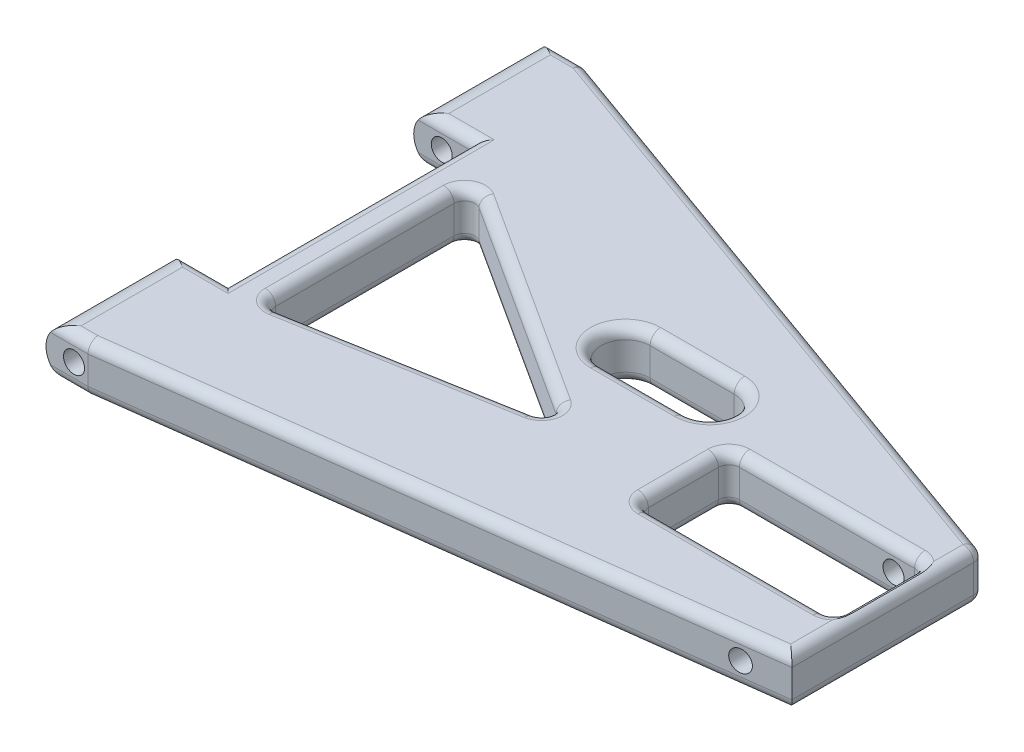
from build123d import *

# Parameters (mm, degrees)
A_ARM_SKETCH_W          = 28
A_ARM_SKETCH_H          = 13
MAIN_EXTRUDE_DEPTH      = 7
COMPLETE_FILLET_R       = 1.5
FILLET2_R               = 3.5
CUT_EXTRUDE1_DEPTH      = 61.922106387
CUT_EXTRUDE1_DEPTH_BACK = 61.922106387
SKETCH1_R               = 1.5
CUT_EXTRUDE2_DEPTH      = 72.144219873
CUT_EXTRUDE2_DEPTH_BACK = 72.144219873
SKETCH2_R               = 1.5


with BuildPart() as part:
    # A_Arm_Sketch → Main_Extrude (new body)
    with BuildSketch(Plane(origin=(0, 0, 0), x_dir=(1, 0, 0), z_dir=(0, 1, 0))):
        Polygon((47.5, -23.500040376), (47.5, 3.500040376), (-40.5, 35), (-47.5, 35), (-47.5, 17.5), (-39, 17.5), (-39, -17.5), (-47.5, -17.5), (-47.5, -35), (-41.5, -35), align=None)
        Polygon((-34, -17.5), (-34, 12.5), (2.5, -11.042410591), align=None, mode=Mode.SUBTRACT)
        with Locations((31.500807525, -9.000040376)):
            Rectangle(A_ARM_SKETCH_W, A_ARM_SKETCH_H, mode=Mode.SUBTRACT)
        with BuildLine():
            ThreePointArc((-2.415267105, -0.833141073), (-5.915267105, 2.666858927), (-2.415267105, 6.166858927))
            Line((-2.415267105, 6.166858927), (9.584732895, 6.166858927))
            ThreePointArc((9.584732895, 6.166858927), (13.084732895, 2.666858927), (9.584732895, -0.833141073))
            Line((9.584732895, -0.833141073), (-2.415267105, -0.833141073))
        make_face(mode=Mode.SUBTRACT)
    extrude(amount=MAIN_EXTRUDE_DEPTH)

    # Complete_Fillet
    # the kernel refuses this fillet: 1.5 mm, written as the material it adds along each edge
    with BuildSketch(Plane(origin=(17.500807525, 0, 2.500040376), x_dir=(0, 0, 1), z_dir=(0, 1, 0)), Plane(origin=(45.500807525, 0, 15.500040376), x_dir=(0, 0, -1), z_dir=(0, 1, 0)), Plane(origin=(45.500807525, 0, 2.500040376), x_dir=(-1, 0, 0), z_dir=(0, 1, 0))) as complete_fillet_piece_1:
        with BuildLine():
            CenterArc((COMPLETE_FILLET_R, COMPLETE_FILLET_R), COMPLETE_FILLET_R, 180, 90)
            Line((0, COMPLETE_FILLET_R), (0, 0))
            Line((0, 0), (COMPLETE_FILLET_R, 0))
        make_face()
    extrude(amount=7)
    with BuildSketch(Plane(origin=(17.500807525, 0, 15.500040376), x_dir=(0, 0, -1), z_dir=(0, 1, 0))) as complete_fillet_piece_2:
        with BuildLine():
            CenterArc((COMPLETE_FILLET_R, -COMPLETE_FILLET_R), COMPLETE_FILLET_R, 90, 90)
            Line((0, -COMPLETE_FILLET_R), (0, 0))
            Line((0, 0), (COMPLETE_FILLET_R, 0))
        make_face()
    extrude(amount=7)
    with BuildSketch(Plane(origin=(-34, 0, 17.5), x_dir=(0, 0, -1), z_dir=(0, 1, 0))) as complete_fillet_piece_3:
        with BuildLine():
            CenterArc((COMPLETE_FILLET_R * 1.19245005923, -COMPLETE_FILLET_R), COMPLETE_FILLET_R, 90, 100.032963932)
            Line((COMPLETE_FILLET_R * 0.207742374056, -COMPLETE_FILLET_R * 1.17421473751), (0, 0))
            Line((0, 0), (COMPLETE_FILLET_R * 1.19245005923, 0))
        make_face()
    extrude(amount=7)
    with BuildSketch(Plane(origin=(2.5, 0, 11.042410591), x_dir=(-0.8403593260849083, 0, -0.5420297068077715), z_dir=(0, 1, 0))) as complete_fillet_piece_4:
        with BuildLine():
            CenterArc((COMPLETE_FILLET_R * 2.54810634239, COMPLETE_FILLET_R), COMPLETE_FILLET_R, 132.854880893, 137.145119107)
            Line((COMPLETE_FILLET_R * 1.8679625451, COMPLETE_FILLET_R * 1.73307872361), (0, 0))
            Line((0, 0), (COMPLETE_FILLET_R * 2.54810634239, 0))
        make_face()
    extrude(amount=7)
    with BuildSketch(Plane(origin=(-34, 0, -12.5), x_dir=(0, 0, 1), z_dir=(0, 1, 0))) as complete_fillet_piece_5:
        with BuildLine():
            CenterArc((COMPLETE_FILLET_R * 1.83496470967, COMPLETE_FILLET_R), COMPLETE_FILLET_R, 147.178083039, 122.821916961)
            Line((COMPLETE_FILLET_R * 0.994605383585, COMPLETE_FILLET_R * 1.54202970681), (0, 0))
            Line((0, 0), (COMPLETE_FILLET_R * 1.83496470967, 0))
        make_face()
    extrude(amount=7)
    # the kernel refuses this fillet: 1.5 mm, written as the material it takes off along each edge
    with BuildSketch(Plane(origin=(-40.760376302, 1.5, -33.5), x_dir=(0, 0, -1), z_dir=(0, -1, 0))) as complete_fillet_2_piece_1_section:
        Polygon((0, 0), (COMPLETE_FILLET_R, 0), (COMPLETE_FILLET_R, COMPLETE_FILLET_R * 0.173584201037), (COMPLETE_FILLET_R * 0.941499749138, COMPLETE_FILLET_R * 0.337013682768), align=None)
    complete_fillet_2_piece_1 = extrude(amount=COMPLETE_FILLET_R, mode=Mode.PRIVATE)
    complete_fillet_2_piece_1 = complete_fillet_2_piece_1 - Plane(origin=(-40.760376302, 1.5, -33.5), x_dir=(-0.17102668046529312, 0, 0.9852663977671331), z_dir=(0, -1, 0)) * Sphere(COMPLETE_FILLET_R, mode=Mode.PRIVATE)
    add(complete_fillet_2_piece_1, mode=Mode.SUBTRACT)
    with BuildSketch(Plane(origin=(46, 1.5, -2.443768745), x_dir=(1, 0, 0), z_dir=(0, -1, 0))) as complete_fillet_2_piece_2_section:
        Polygon((0, 0), (COMPLETE_FILLET_R, 0), (COMPLETE_FILLET_R, -COMPLETE_FILLET_R * 0.704181087503), (COMPLETE_FILLET_R * 0.337013682768, -COMPLETE_FILLET_R * 0.941499749138), align=None)
    complete_fillet_2_piece_2 = extrude(amount=COMPLETE_FILLET_R, mode=Mode.PRIVATE)
    complete_fillet_2_piece_2 = complete_fillet_2_piece_2 - Plane(origin=(46, 1.5, -2.443768745), x_dir=(-0.817622676657215, 0, 0.5757544256155495), z_dir=(0, -1, 0)) * Sphere(COMPLETE_FILLET_R, mode=Mode.PRIVATE)
    add(complete_fillet_2_piece_2, mode=Mode.SUBTRACT)
    with BuildSketch(Plane(origin=(-40.760376302, 5.5, -33.5), x_dir=(0, 0, -1), z_dir=(0, 1, 0))) as complete_fillet_2_piece_3_section:
        Polygon((0, 0), (COMPLETE_FILLET_R, 0), (COMPLETE_FILLET_R, -COMPLETE_FILLET_R * 0.173584201037), (COMPLETE_FILLET_R * 0.941499749138, -COMPLETE_FILLET_R * 0.337013682768), align=None)
    complete_fillet_2_piece_3 = extrude(amount=COMPLETE_FILLET_R, mode=Mode.PRIVATE)
    complete_fillet_2_piece_3 = complete_fillet_2_piece_3 - Plane(origin=(-40.760376302, 5.5, -33.5), x_dir=(-0.17102668046529312, 0, 0.9852663977671331), z_dir=(0, 1, 0)) * Sphere(COMPLETE_FILLET_R, mode=Mode.PRIVATE)
    add(complete_fillet_2_piece_3, mode=Mode.SUBTRACT)
    with BuildSketch(Plane(origin=(46, 5.5, -2.443768745), x_dir=(1, 0, 0), z_dir=(0, 1, 0))) as complete_fillet_2_piece_4_section:
        Polygon((0, 0), (COMPLETE_FILLET_R, 0), (COMPLETE_FILLET_R, COMPLETE_FILLET_R * 0.704181087503), (COMPLETE_FILLET_R * 0.337013682768, COMPLETE_FILLET_R * 0.941499749138), align=None)
    complete_fillet_2_piece_4 = extrude(amount=COMPLETE_FILLET_R, mode=Mode.PRIVATE)
    complete_fillet_2_piece_4 = complete_fillet_2_piece_4 - Plane(origin=(46, 5.5, -2.443768745), x_dir=(-0.817622676657215, 0, 0.5757544256155495), z_dir=(0, 1, 0)) * Sphere(COMPLETE_FILLET_R, mode=Mode.PRIVATE)
    add(complete_fillet_2_piece_4, mode=Mode.SUBTRACT)
    with BuildSketch(Plane(origin=(-39, 7, 17.5), x_dir=(0, 0, 1), z_dir=(-1, 0, 0)), Plane(origin=(-51.25, 7, -17.5), x_dir=(0, 0, -1), z_dir=(1, 0, 0))) as complete_fillet_2_piece_5:
        with BuildLine():
            CenterArc((COMPLETE_FILLET_R, -COMPLETE_FILLET_R), COMPLETE_FILLET_R, 90, 90)
            Line((0, -COMPLETE_FILLET_R), (0, 0))
            Line((0, 0), (COMPLETE_FILLET_R, 0))
        make_face()
    extrude(amount=12.25, mode=Mode.SUBTRACT)
    with BuildSketch(Plane(origin=(9.584732895, 7, 0.833141073), x_dir=(0, 0, 1), z_dir=(-1, 0, 0)), Plane(origin=(-2.415267105, 7, -6.166858927), x_dir=(0, 0, -1), z_dir=(1, 0, 0))) as complete_fillet_2_piece_6:
        with BuildLine():
            CenterArc((COMPLETE_FILLET_R, -COMPLETE_FILLET_R), COMPLETE_FILLET_R, 90, 90)
            Line((0, -COMPLETE_FILLET_R), (0, 0))
            Line((0, 0), (COMPLETE_FILLET_R, 0))
        make_face()
    extrude(amount=12, mode=Mode.SUBTRACT)
    with BuildSketch(Plane(origin=(-2.415267105, 7, -2.666858927), x_dir=(0, 0, 1), z_dir=(1, 0, 0))) as complete_fillet_2_piece_7:
        with BuildLine():
            CenterArc((3.5 + COMPLETE_FILLET_R, COMPLETE_FILLET_R), COMPLETE_FILLET_R, 180, 90)
            Line((3.5, COMPLETE_FILLET_R), (3.5, 0))
            Line((3.5, 0), (3.5 + COMPLETE_FILLET_R, 0))
        make_face()
    revolve(axis=Axis((-2.415267105, 7, -2.666858927), (0, -1, 0)), revolution_arc=180, mode=Mode.SUBTRACT)
    with BuildSketch(Plane(origin=(-39, 0, 17.5), x_dir=(0, 0, 1), z_dir=(-1, 0, 0)), Plane(origin=(-51.25, 0, -17.5), x_dir=(0, 0, -1), z_dir=(1, 0, 0))) as complete_fillet_2_piece_8:
        with BuildLine():
            CenterArc((COMPLETE_FILLET_R, COMPLETE_FILLET_R), COMPLETE_FILLET_R, 180, 90)
            Line((0, COMPLETE_FILLET_R), (0, 0))
            Line((0, 0), (COMPLETE_FILLET_R, 0))
        make_face()
    extrude(amount=12.25, mode=Mode.SUBTRACT)
    with BuildSketch(Plane(origin=(-39, 0, -17.5), x_dir=(1, 0, 0), z_dir=(0, 0, 1))) as complete_fillet_2_piece_9:
        with BuildLine():
            CenterArc((COMPLETE_FILLET_R, COMPLETE_FILLET_R), COMPLETE_FILLET_R, 180, 90)
            Line((0, COMPLETE_FILLET_R), (0, 0))
            Line((0, 0), (COMPLETE_FILLET_R, 0))
        make_face()
    extrude(amount=35, mode=Mode.SUBTRACT)
    with BuildSketch(Plane(origin=(-40.760376302, 0, -35), x_dir=(0, 0, 1), z_dir=(-1, 0, 0))) as complete_fillet_2_piece_10:
        with BuildLine():
            CenterArc((COMPLETE_FILLET_R, COMPLETE_FILLET_R), COMPLETE_FILLET_R, 180, 90)
            Line((0, COMPLETE_FILLET_R), (0, 0))
            Line((0, 0), (COMPLETE_FILLET_R, 0))
        make_face()
    extrude(amount=10.489623698, mode=Mode.SUBTRACT)
    with BuildSketch(Plane(origin=(46.505520524, 0, -3.856018369), x_dir=(0, 1, 0), z_dir=(-0.9414997491380458, 0, -0.3370136827682178))) as complete_fillet_2_piece_11:
        with BuildLine():
            CenterArc((COMPLETE_FILLET_R, -COMPLETE_FILLET_R), COMPLETE_FILLET_R, 90, 90)
            Line((0, -COMPLETE_FILLET_R), (0, 0))
            Line((0, 0), (COMPLETE_FILLET_R, 0))
        make_face()
    extrude(amount=92.151247391, mode=Mode.SUBTRACT)
    with BuildSketch(Plane(origin=(47.5, 0, 27.250040376), x_dir=(0, 1, 0), z_dir=(0, 0, -1))) as complete_fillet_2_piece_12:
        with BuildLine():
            CenterArc((COMPLETE_FILLET_R, -COMPLETE_FILLET_R), COMPLETE_FILLET_R, 90, 90)
            Line((0, -COMPLETE_FILLET_R), (0, 0))
            Line((0, 0), (COMPLETE_FILLET_R, 0))
        make_face()
    extrude(amount=29.693809121, mode=Mode.SUBTRACT)
    with BuildSketch(Plane(origin=(-45.219081613, 0, 35.480553802), x_dir=(0, 1, 0), z_dir=(0.991755096769424, 0, -0.12814768055595332))) as complete_fillet_2_piece_13:
        with BuildLine():
            CenterArc((COMPLETE_FILLET_R, -COMPLETE_FILLET_R), COMPLETE_FILLET_R, 90, 90)
            Line((0, -COMPLETE_FILLET_R), (0, 0))
            Line((0, 0), (COMPLETE_FILLET_R, 0))
        make_face()
    extrude(amount=97.239896765, mode=Mode.SUBTRACT)
    with BuildSketch(Plane(origin=(-51.25, 0, 35), x_dir=(0, 0, -1), z_dir=(1, 0, 0))) as complete_fillet_2_piece_14:
        with BuildLine():
            CenterArc((COMPLETE_FILLET_R, COMPLETE_FILLET_R), COMPLETE_FILLET_R, 180, 90)
            Line((0, COMPLETE_FILLET_R), (0, 0))
            Line((0, 0), (COMPLETE_FILLET_R, 0))
        make_face()
    extrude(amount=13.5, mode=Mode.SUBTRACT)
    with BuildSketch(Plane(origin=(-2.415267105, 0, -6.166858927), x_dir=(0, 0, -1), z_dir=(1, 0, 0)), Plane(origin=(9.584732895, 0, 0.833141073), x_dir=(0, 0, 1), z_dir=(-1, 0, 0))) as complete_fillet_2_piece_15:
        with BuildLine():
            CenterArc((COMPLETE_FILLET_R, COMPLETE_FILLET_R), COMPLETE_FILLET_R, 180, 90)
            Line((0, COMPLETE_FILLET_R), (0, 0))
            Line((0, 0), (COMPLETE_FILLET_R, 0))
        make_face()
    extrude(amount=12, mode=Mode.SUBTRACT)
    with BuildSketch(Plane(origin=(-2.415267105, 0, -2.666858927), x_dir=(0, 0, 1), z_dir=(1, 0, 0))) as complete_fillet_2_piece_16:
        with BuildLine():
            CenterArc((3.5 + COMPLETE_FILLET_R, -COMPLETE_FILLET_R), COMPLETE_FILLET_R, 90, 90)
            Line((3.5, -COMPLETE_FILLET_R), (3.5, 0))
            Line((3.5, 0), (3.5 + COMPLETE_FILLET_R, 0))
        make_face()
    revolve(axis=Axis((-2.415267105, 0, -2.666858927), (0, -1, 0)), revolution_arc=180, mode=Mode.SUBTRACT)
    with BuildSketch(Plane(origin=(9.584732895, 0, -2.666858927), x_dir=(0, 0, -1), z_dir=(-1, 0, 0))) as complete_fillet_2_piece_17:
        with BuildLine():
            CenterArc((3.5 + COMPLETE_FILLET_R, -COMPLETE_FILLET_R), COMPLETE_FILLET_R, 90, 90)
            Line((3.5, -COMPLETE_FILLET_R), (3.5, 0))
            Line((3.5, 0), (3.5 + COMPLETE_FILLET_R, 0))
        make_face()
    revolve(axis=Axis((9.584732895, 0, -2.666858927), (0, -1, 0)), revolution_arc=180, mode=Mode.SUBTRACT)
    with BuildSketch(Plane(origin=(-40.5, 1.5, -35), x_dir=(0.9414997491380386, 0, 0.3370136827682381), z_dir=(0, 1, 0))) as complete_fillet_2_piece_18:
        with BuildLine():
            CenterArc((COMPLETE_FILLET_R * 0.173584201037, -COMPLETE_FILLET_R), COMPLETE_FILLET_R, 90, 19.695035566)
            Line((-COMPLETE_FILLET_R * 0.163429481731, -COMPLETE_FILLET_R * 0.058500250862), (0, 0))
            Line((0, 0), (COMPLETE_FILLET_R * 0.173584201037, 0))
        make_face()
    extrude(amount=4, mode=Mode.SUBTRACT)
    with BuildSketch(Plane(origin=(47.5, 1.5, -3.500040376), x_dir=(0, 0, 1), z_dir=(0, 1, 0))) as complete_fillet_2_piece_19:
        with BuildLine():
            CenterArc((COMPLETE_FILLET_R * 0.704181087503, -COMPLETE_FILLET_R), COMPLETE_FILLET_R, 90, 70.304964434)
            Line((-COMPLETE_FILLET_R * 0.237318661635, -COMPLETE_FILLET_R * 0.662986317232), (0, 0))
            Line((0, 0), (COMPLETE_FILLET_R * 0.704181087503, 0))
        make_face()
    extrude(amount=4, mode=Mode.SUBTRACT)
    with BuildSketch(Plane(origin=(-51.25, 7, 35), x_dir=(0, 0, -1), z_dir=(1, 0, 0))) as complete_fillet_2_piece_20:
        with BuildLine():
            CenterArc((COMPLETE_FILLET_R, -COMPLETE_FILLET_R), COMPLETE_FILLET_R, 90, 90)
            Line((0, -COMPLETE_FILLET_R), (0, 0))
            Line((0, 0), (COMPLETE_FILLET_R, 0))
        make_face()
    extrude(amount=13.5, mode=Mode.SUBTRACT)
    with BuildSketch(Plane(origin=(-45.219081613, 7, 35.480553802), x_dir=(0, -1, 0), z_dir=(0.991755096769424, 0, -0.12814768055595332))) as complete_fillet_2_piece_21:
        with BuildLine():
            CenterArc((COMPLETE_FILLET_R, COMPLETE_FILLET_R), COMPLETE_FILLET_R, 180, 90)
            Line((0, COMPLETE_FILLET_R), (0, 0))
            Line((0, 0), (COMPLETE_FILLET_R, 0))
        make_face()
    extrude(amount=97.239896765, mode=Mode.SUBTRACT)
    with BuildSketch(Plane(origin=(47.5, 7, 27.250040376), x_dir=(0, -1, 0), z_dir=(0, 0, -1))) as complete_fillet_2_piece_22:
        with BuildLine():
            CenterArc((COMPLETE_FILLET_R, COMPLETE_FILLET_R), COMPLETE_FILLET_R, 180, 90)
            Line((0, COMPLETE_FILLET_R), (0, 0))
            Line((0, 0), (COMPLETE_FILLET_R, 0))
        make_face()
    extrude(amount=29.693809121, mode=Mode.SUBTRACT)
    with BuildSketch(Plane(origin=(46.505520524, 7, -3.856018369), x_dir=(0, -1, 0), z_dir=(-0.9414997491380458, 0, -0.3370136827682178))) as complete_fillet_2_piece_23:
        with BuildLine():
            CenterArc((COMPLETE_FILLET_R, COMPLETE_FILLET_R), COMPLETE_FILLET_R, 180, 90)
            Line((0, COMPLETE_FILLET_R), (0, 0))
            Line((0, 0), (COMPLETE_FILLET_R, 0))
        make_face()
    extrude(amount=92.151247391, mode=Mode.SUBTRACT)
    with BuildSketch(Plane(origin=(-40.760376302, 7, -35), x_dir=(0, 0, 1), z_dir=(-1, 0, 0))) as complete_fillet_2_piece_24:
        with BuildLine():
            CenterArc((COMPLETE_FILLET_R, -COMPLETE_FILLET_R), COMPLETE_FILLET_R, 90, 90)
            Line((0, -COMPLETE_FILLET_R), (0, 0))
            Line((0, 0), (COMPLETE_FILLET_R, 0))
        make_face()
    extrude(amount=10.489623698, mode=Mode.SUBTRACT)
    with BuildSketch(Plane(origin=(9.584732895, 7, -2.666858927), x_dir=(0, 0, -1), z_dir=(-1, 0, 0))) as complete_fillet_2_piece_25:
        with BuildLine():
            CenterArc((3.5 + COMPLETE_FILLET_R, COMPLETE_FILLET_R), COMPLETE_FILLET_R, 180, 90)
            Line((3.5, COMPLETE_FILLET_R), (3.5, 0))
            Line((3.5, 0), (3.5 + COMPLETE_FILLET_R, 0))
        make_face()
    revolve(axis=Axis((9.584732895, 7, -2.666858927), (0, -1, 0)), revolution_arc=180, mode=Mode.SUBTRACT)
    with BuildSketch(Plane(origin=(-39, 7, -17.5), x_dir=(1, 0, 0), z_dir=(0, 0, 1))) as complete_fillet_2_piece_26:
        with BuildLine():
            CenterArc((COMPLETE_FILLET_R, -COMPLETE_FILLET_R), COMPLETE_FILLET_R, 90, 90)
            Line((0, -COMPLETE_FILLET_R), (0, 0))
            Line((0, 0), (COMPLETE_FILLET_R, 0))
        make_face()
    extrude(amount=35, mode=Mode.SUBTRACT)
    with BuildSketch(Plane(origin=(-39, 7, -17.5), x_dir=(1, 0, 0), z_dir=(0, 0, 1))) as complete_fillet_2_piece_27a_section:
        with BuildLine():
            CenterArc((COMPLETE_FILLET_R, -COMPLETE_FILLET_R), COMPLETE_FILLET_R, 90, 90)
            Line((0, -COMPLETE_FILLET_R), (0, 0))
            Line((0, 0), (COMPLETE_FILLET_R, 0))
        make_face()
    complete_fillet_2_piece_27a = extrude(amount=38.75, mode=Mode.PRIVATE)
    complete_fillet_2_piece_27a = split(complete_fillet_2_piece_27a, bisect_by=Plane(origin=(-38.660407329, 6.660407329, 17.5), z_dir=(0, 0, 1)), keep=Keep.TOP, mode=Mode.PRIVATE)
    with BuildSketch(Plane(origin=(-35.25, 7, 17.5), x_dir=(0, 0, 1), z_dir=(-1, 0, 0))) as complete_fillet_2_piece_27b_section:
        with BuildLine():
            CenterArc((COMPLETE_FILLET_R, -COMPLETE_FILLET_R), COMPLETE_FILLET_R, 90, 90)
            Line((0, -COMPLETE_FILLET_R), (0, 0))
            Line((0, 0), (COMPLETE_FILLET_R, 0))
        make_face()
    complete_fillet_2_piece_27b = extrude(amount=16, mode=Mode.PRIVATE)
    complete_fillet_2_piece_27b = split(complete_fillet_2_piece_27b, bisect_by=Plane(origin=(-39, 6.660407329, 17.839592671), z_dir=(1, 0, 0)), keep=Keep.TOP, mode=Mode.PRIVATE)
    complete_fillet_2_piece_27 = complete_fillet_2_piece_27a & complete_fillet_2_piece_27b
    add(complete_fillet_2_piece_27, mode=Mode.SUBTRACT)
    with BuildSketch(Plane(origin=(-39, 0, -17.5), x_dir=(1, 0, 0), z_dir=(0, 0, 1))) as complete_fillet_2_piece_28a_section:
        with BuildLine():
            CenterArc((COMPLETE_FILLET_R, COMPLETE_FILLET_R), COMPLETE_FILLET_R, 180, 90)
            Line((0, COMPLETE_FILLET_R), (0, 0))
            Line((0, 0), (COMPLETE_FILLET_R, 0))
        make_face()
    complete_fillet_2_piece_28a = extrude(amount=38.75, mode=Mode.PRIVATE)
    complete_fillet_2_piece_28a = split(complete_fillet_2_piece_28a, bisect_by=Plane(origin=(-38.660407329, 0.339592671, 17.5), z_dir=(0, 0, 1)), keep=Keep.TOP, mode=Mode.PRIVATE)
    with BuildSketch(Plane(origin=(-35.25, 0, 17.5), x_dir=(0, 0, 1), z_dir=(-1, 0, 0))) as complete_fillet_2_piece_28b_section:
        with BuildLine():
            CenterArc((COMPLETE_FILLET_R, COMPLETE_FILLET_R), COMPLETE_FILLET_R, 180, 90)
            Line((0, COMPLETE_FILLET_R), (0, 0))
            Line((0, 0), (COMPLETE_FILLET_R, 0))
        make_face()
    complete_fillet_2_piece_28b = extrude(amount=16, mode=Mode.PRIVATE)
    complete_fillet_2_piece_28b = split(complete_fillet_2_piece_28b, bisect_by=Plane(origin=(-39, 0.339592671, 17.839592671), z_dir=(1, 0, 0)), keep=Keep.TOP, mode=Mode.PRIVATE)
    complete_fillet_2_piece_28 = complete_fillet_2_piece_28a & complete_fillet_2_piece_28b
    add(complete_fillet_2_piece_28, mode=Mode.SUBTRACT)
    with BuildSketch(Plane(origin=(-51.25, 0, -17.5), x_dir=(0, 0, -1), z_dir=(1, 0, 0))) as complete_fillet_2_piece_29a_section:
        with BuildLine():
            CenterArc((COMPLETE_FILLET_R, COMPLETE_FILLET_R), COMPLETE_FILLET_R, 180, 90)
            Line((0, COMPLETE_FILLET_R), (0, 0))
            Line((0, 0), (COMPLETE_FILLET_R, 0))
        make_face()
    complete_fillet_2_piece_29a = extrude(amount=16, mode=Mode.PRIVATE)
    complete_fillet_2_piece_29a = split(complete_fillet_2_piece_29a, bisect_by=Plane(origin=(-39, 0.339592671, -17.839592671), z_dir=(1, 0, 0)), keep=Keep.TOP, mode=Mode.PRIVATE)
    with BuildSketch(Plane(origin=(-39, 0, -21.25), x_dir=(1, 0, 0), z_dir=(0, 0, 1))) as complete_fillet_2_piece_29b_section:
        with BuildLine():
            CenterArc((COMPLETE_FILLET_R, COMPLETE_FILLET_R), COMPLETE_FILLET_R, 180, 90)
            Line((0, COMPLETE_FILLET_R), (0, 0))
            Line((0, 0), (COMPLETE_FILLET_R, 0))
        make_face()
    complete_fillet_2_piece_29b = extrude(amount=38.75, mode=Mode.PRIVATE)
    complete_fillet_2_piece_29b = split(complete_fillet_2_piece_29b, bisect_by=Plane(origin=(-38.660407329, 0.339592671, -17.5), z_dir=(0, 0, -1)), keep=Keep.TOP, mode=Mode.PRIVATE)
    complete_fillet_2_piece_29 = complete_fillet_2_piece_29a & complete_fillet_2_piece_29b
    add(complete_fillet_2_piece_29, mode=Mode.SUBTRACT)
    with BuildSketch(Plane(origin=(-51.25, 7, -17.5), x_dir=(0, 0, -1), z_dir=(1, 0, 0))) as complete_fillet_2_piece_30a_section:
        with BuildLine():
            CenterArc((COMPLETE_FILLET_R, -COMPLETE_FILLET_R), COMPLETE_FILLET_R, 90, 90)
            Line((0, -COMPLETE_FILLET_R), (0, 0))
            Line((0, 0), (COMPLETE_FILLET_R, 0))
        make_face()
    complete_fillet_2_piece_30a = extrude(amount=16, mode=Mode.PRIVATE)
    complete_fillet_2_piece_30a = split(complete_fillet_2_piece_30a, bisect_by=Plane(origin=(-39, 6.660407329, -17.839592671), z_dir=(1, 0, 0)), keep=Keep.TOP, mode=Mode.PRIVATE)
    with BuildSketch(Plane(origin=(-39, 7, -21.25), x_dir=(1, 0, 0), z_dir=(0, 0, 1))) as complete_fillet_2_piece_30b_section:
        with BuildLine():
            CenterArc((COMPLETE_FILLET_R, -COMPLETE_FILLET_R), COMPLETE_FILLET_R, 90, 90)
            Line((0, -COMPLETE_FILLET_R), (0, 0))
            Line((0, 0), (COMPLETE_FILLET_R, 0))
        make_face()
    complete_fillet_2_piece_30b = extrude(amount=38.75, mode=Mode.PRIVATE)
    complete_fillet_2_piece_30b = split(complete_fillet_2_piece_30b, bisect_by=Plane(origin=(-38.660407329, 6.660407329, -17.5), z_dir=(0, 0, -1)), keep=Keep.TOP, mode=Mode.PRIVATE)
    complete_fillet_2_piece_30 = complete_fillet_2_piece_30a & complete_fillet_2_piece_30b
    add(complete_fillet_2_piece_30, mode=Mode.SUBTRACT)
    # the kernel refuses this fillet: 1.5 mm, written as the material it takes off along each edge
    with BuildSketch(Plane(origin=(-34, 7, 15.711324911), x_dir=(-1, 0, 0), z_dir=(0, 0, -1)), Plane(origin=(-34, 0, 15.711324911), x_dir=(0, 1, 0), z_dir=(0, 0, -1))) as complete_fillet_3_piece_1:
        with BuildLine():
            CenterArc((COMPLETE_FILLET_R, -COMPLETE_FILLET_R), COMPLETE_FILLET_R, 90, 90)
            Line((0, -COMPLETE_FILLET_R), (0, 0))
            Line((0, 0), (COMPLETE_FILLET_R, 0))
        make_face()
    extrude(amount=25.458877847, mode=Mode.SUBTRACT)
    with BuildSketch(Plane(origin=(17.500807525, 0, 14.000040376), x_dir=(0, 1, 0), z_dir=(0, 0, -1)), Plane(origin=(45.500807525, 0, 4.000040376), x_dir=(0, 1, 0), z_dir=(0, 0, 1)), Plane(origin=(45.500807525, 7, 4.000040376), x_dir=(1, 0, 0), z_dir=(0, 0, 1)), Plane(origin=(17.500807525, 7, 14.000040376), x_dir=(-1, 0, 0), z_dir=(0, 0, -1))) as complete_fillet_3_piece_2:
        with BuildLine():
            CenterArc((COMPLETE_FILLET_R, -COMPLETE_FILLET_R), COMPLETE_FILLET_R, 90, 90)
            Line((0, -COMPLETE_FILLET_R), (0, 0))
            Line((0, 0), (COMPLETE_FILLET_R, 0))
        make_face()
    extrude(amount=10, mode=Mode.SUBTRACT)
    with BuildSketch(Plane(origin=(44.000807525, 0, 15.500040376), x_dir=(0, 1, 0), z_dir=(-1, 0, 0)), Plane(origin=(19.000807525, 0, 2.500040376), x_dir=(0, 1, 0), z_dir=(1, 0, 0)), Plane(origin=(19.000807525, 7, 2.500040376), x_dir=(0, 0, -1), z_dir=(1, 0, 0)), Plane(origin=(44.000807525, 7, 15.500040376), x_dir=(0, 0, 1), z_dir=(-1, 0, 0))) as complete_fillet_3_piece_3:
        with BuildLine():
            CenterArc((COMPLETE_FILLET_R, -COMPLETE_FILLET_R), COMPLETE_FILLET_R, 90, 90)
            Line((0, -COMPLETE_FILLET_R), (0, 0))
            Line((0, 0), (COMPLETE_FILLET_R, 0))
        make_face()
    extrude(amount=25, mode=Mode.SUBTRACT)
    with BuildSketch(Plane(origin=(-1.263709847, 0, 11.708287107), x_dir=(0, 1, 0), z_dir=(-0.9847076851715917, 0, 0.17421473750519956)), Plane(origin=(-1.263709847, 7, 11.708287107), x_dir=(0.17421473750519953, 0, 0.9847076851715917), z_dir=(-0.9847076851715917, 0, 0.17421473750519956))) as complete_fillet_3_piece_4:
        with BuildLine():
            CenterArc((COMPLETE_FILLET_R, -COMPLETE_FILLET_R), COMPLETE_FILLET_R, 90, 90)
            Line((0, -COMPLETE_FILLET_R), (0, 0))
            Line((0, 0), (COMPLETE_FILLET_R, 0))
        make_face()
    extrude(amount=31.45600315, mode=Mode.SUBTRACT)
    with BuildSketch(Plane(origin=(-31.68695544, 0, -11.008091925), x_dir=(0, 1, 0), z_dir=(0.8403593260849086, 0, 0.5420297068077712)), Plane(origin=(-31.68695544, 7, -11.008091925), x_dir=(0.5420297068077712, 0, -0.8403593260849085), z_dir=(0.8403593260849086, 0, 0.5420297068077712))) as complete_fillet_3_piece_5:
        with BuildLine():
            CenterArc((COMPLETE_FILLET_R, -COMPLETE_FILLET_R), COMPLETE_FILLET_R, 90, 90)
            Line((0, -COMPLETE_FILLET_R), (0, 0))
            Line((0, 0), (COMPLETE_FILLET_R, 0))
        make_face()
    extrude(amount=36.859194734, mode=Mode.SUBTRACT)
    with BuildSketch(Plane(origin=(19.000807525, 7, 14.000040376), x_dir=(-1, 0, 0), z_dir=(0, 0, -1))) as complete_fillet_3_piece_6:
        with BuildLine():
            CenterArc((1.5 + COMPLETE_FILLET_R, -COMPLETE_FILLET_R), COMPLETE_FILLET_R, 90, 90)
            Line((1.5, -COMPLETE_FILLET_R), (1.5, 0))
            Line((1.5, 0), (1.5 + COMPLETE_FILLET_R, 0))
        make_face()
    revolve(axis=Axis((19.000807525, 7, 14.000040376), (0, 1, 0)), revolution_arc=90, mode=Mode.SUBTRACT)
    with BuildSketch(Plane(origin=(19.000807525, 7, 4.000040376), x_dir=(-1, 0, 0), z_dir=(0, 0, 1))) as complete_fillet_3_piece_7:
        with BuildLine():
            CenterArc((1.5 + COMPLETE_FILLET_R, COMPLETE_FILLET_R), COMPLETE_FILLET_R, 180, 90)
            Line((1.5, COMPLETE_FILLET_R), (1.5, 0))
            Line((1.5, 0), (1.5 + COMPLETE_FILLET_R, 0))
        make_face()
    revolve(axis=Axis((19.000807525, 7, 4.000040376), (0, -1, 0)), revolution_arc=90, mode=Mode.SUBTRACT)
    with BuildSketch(Plane(origin=(44.000807525, 7, 14.000040376), x_dir=(1, 0, 0), z_dir=(0, 0, -1))) as complete_fillet_3_piece_8:
        with BuildLine():
            CenterArc((1.5 + COMPLETE_FILLET_R, COMPLETE_FILLET_R), COMPLETE_FILLET_R, 180, 90)
            Line((1.5, COMPLETE_FILLET_R), (1.5, 0))
            Line((1.5, 0), (1.5 + COMPLETE_FILLET_R, 0))
        make_face()
    revolve(axis=Axis((44.000807525, 7, 14.000040376), (0, -1, 0)), revolution_arc=90, mode=Mode.SUBTRACT)
    with BuildSketch(Plane(origin=(44.000807525, 7, 4.000040376), x_dir=(0, 0, -1), z_dir=(-1, 0, 0))) as complete_fillet_3_piece_9:
        with BuildLine():
            CenterArc((1.5 + COMPLETE_FILLET_R, COMPLETE_FILLET_R), COMPLETE_FILLET_R, 180, 90)
            Line((1.5, COMPLETE_FILLET_R), (1.5, 0))
            Line((1.5, 0), (1.5 + COMPLETE_FILLET_R, 0))
        make_face()
    revolve(axis=Axis((44.000807525, 7, 4.000040376), (0, -1, 0)), revolution_arc=90, mode=Mode.SUBTRACT)
    with BuildSketch(Plane(origin=(-1.525031953, 7, 10.231225579), x_dir=(0.5420297068077707, 0, -0.8403593260849089), z_dir=(-0.8403593260849089, 0, -0.5420297068077707))) as complete_fillet_3_piece_10:
        with BuildLine():
            CenterArc((1.5 + COMPLETE_FILLET_R, COMPLETE_FILLET_R), COMPLETE_FILLET_R, 180, 90)
            Line((1.5, COMPLETE_FILLET_R), (1.5, 0))
            Line((1.5, 0), (1.5 + COMPLETE_FILLET_R, 0))
        make_face()
    revolve(axis=Axis((-1.525031953, 7, 10.231225579), (0, -1, 0)), revolution_arc=137.145119107, mode=Mode.SUBTRACT)
    with BuildSketch(Plane(origin=(-32.5, 7, 15.711324911), x_dir=(-1, 0, 0), z_dir=(0, 0, -1))) as complete_fillet_3_piece_11:
        with BuildLine():
            CenterArc((1.5 + COMPLETE_FILLET_R, -COMPLETE_FILLET_R), COMPLETE_FILLET_R, 90, 90)
            Line((1.5, -COMPLETE_FILLET_R), (1.5, 0))
            Line((1.5, 0), (1.5 + COMPLETE_FILLET_R, 0))
        make_face()
    revolve(axis=Axis((-32.5, 7, 15.711324911), (0, 1, 0)), revolution_arc=100.032963932, mode=Mode.SUBTRACT)
    with BuildSketch(Plane(origin=(-32.5, 7, -9.747552935), x_dir=(-1, 0, 0), z_dir=(0, 0, 1))) as complete_fillet_3_piece_12:
        with BuildLine():
            CenterArc((1.5 + COMPLETE_FILLET_R, COMPLETE_FILLET_R), COMPLETE_FILLET_R, 180, 90)
            Line((1.5, COMPLETE_FILLET_R), (1.5, 0))
            Line((1.5, 0), (1.5 + COMPLETE_FILLET_R, 0))
        make_face()
    revolve(axis=Axis((-32.5, 7, -9.747552935), (0, -1, 0)), revolution_arc=122.821916961, mode=Mode.SUBTRACT)
    with BuildSketch(Plane(origin=(-32.5, 0, 15.711324911), x_dir=(-1, 0, 0), z_dir=(0, 0, -1))) as complete_fillet_3_piece_13:
        with BuildLine():
            CenterArc((1.5 + COMPLETE_FILLET_R, COMPLETE_FILLET_R), COMPLETE_FILLET_R, 180, 90)
            Line((1.5 + COMPLETE_FILLET_R, 0), (1.5, 0))
            Line((1.5, 0), (1.5, COMPLETE_FILLET_R))
        make_face()
    revolve(axis=Axis((-32.5, 0, 15.711324911), (0, 1, 0)), revolution_arc=100.032963932, mode=Mode.SUBTRACT)
    with BuildSketch(Plane(origin=(-32.5, 0, -9.747552935), x_dir=(-1, 0, 0), z_dir=(0, 0, 1))) as complete_fillet_3_piece_14:
        with BuildLine():
            CenterArc((1.5 + COMPLETE_FILLET_R, -COMPLETE_FILLET_R), COMPLETE_FILLET_R, 90, 90)
            Line((1.5 + COMPLETE_FILLET_R, 0), (1.5, 0))
            Line((1.5, 0), (1.5, -COMPLETE_FILLET_R))
        make_face()
    revolve(axis=Axis((-32.5, 0, -9.747552935), (0, -1, 0)), revolution_arc=122.821916961, mode=Mode.SUBTRACT)
    with BuildSketch(Plane(origin=(-1.525031953, 0, 10.231225579), x_dir=(0.5420297068077707, 0, -0.8403593260849089), z_dir=(-0.8403593260849089, 0, -0.5420297068077707))) as complete_fillet_3_piece_15:
        with BuildLine():
            CenterArc((1.5 + COMPLETE_FILLET_R, -COMPLETE_FILLET_R), COMPLETE_FILLET_R, 90, 90)
            Line((1.5 + COMPLETE_FILLET_R, 0), (1.5, 0))
            Line((1.5, 0), (1.5, -COMPLETE_FILLET_R))
        make_face()
    revolve(axis=Axis((-1.525031953, 0, 10.231225579), (0, -1, 0)), revolution_arc=137.145119107, mode=Mode.SUBTRACT)
    with BuildSketch(Plane(origin=(19.000807525, 0, 4.000040376), x_dir=(-1, 0, 0), z_dir=(0, 0, 1))) as complete_fillet_3_piece_16:
        with BuildLine():
            CenterArc((1.5 + COMPLETE_FILLET_R, -COMPLETE_FILLET_R), COMPLETE_FILLET_R, 90, 90)
            Line((1.5 + COMPLETE_FILLET_R, 0), (1.5, 0))
            Line((1.5, 0), (1.5, -COMPLETE_FILLET_R))
        make_face()
    revolve(axis=Axis((19.000807525, 0, 4.000040376), (0, -1, 0)), revolution_arc=90, mode=Mode.SUBTRACT)
    with BuildSketch(Plane(origin=(44.000807525, 0, 4.000040376), x_dir=(0, 0, -1), z_dir=(-1, 0, 0))) as complete_fillet_3_piece_17:
        with BuildLine():
            CenterArc((1.5 + COMPLETE_FILLET_R, -COMPLETE_FILLET_R), COMPLETE_FILLET_R, 90, 90)
            Line((1.5 + COMPLETE_FILLET_R, 0), (1.5, 0))
            Line((1.5, 0), (1.5, -COMPLETE_FILLET_R))
        make_face()
    revolve(axis=Axis((44.000807525, 0, 4.000040376), (0, -1, 0)), revolution_arc=90, mode=Mode.SUBTRACT)
    with BuildSketch(Plane(origin=(44.000807525, 0, 14.000040376), x_dir=(1, 0, 0), z_dir=(0, 0, -1))) as complete_fillet_3_piece_18:
        with BuildLine():
            CenterArc((1.5 + COMPLETE_FILLET_R, -COMPLETE_FILLET_R), COMPLETE_FILLET_R, 90, 90)
            Line((1.5 + COMPLETE_FILLET_R, 0), (1.5, 0))
            Line((1.5, 0), (1.5, -COMPLETE_FILLET_R))
        make_face()
    revolve(axis=Axis((44.000807525, 0, 14.000040376), (0, -1, 0)), revolution_arc=90, mode=Mode.SUBTRACT)
    with BuildSketch(Plane(origin=(19.000807525, 0, 14.000040376), x_dir=(-1, 0, 0), z_dir=(0, 0, -1))) as complete_fillet_3_piece_19:
        with BuildLine():
            CenterArc((1.5 + COMPLETE_FILLET_R, COMPLETE_FILLET_R), COMPLETE_FILLET_R, 180, 90)
            Line((1.5 + COMPLETE_FILLET_R, 0), (1.5, 0))
            Line((1.5, 0), (1.5, COMPLETE_FILLET_R))
        make_face()
    revolve(axis=Axis((19.000807525, 0, 14.000040376), (0, 1, 0)), revolution_arc=90, mode=Mode.SUBTRACT)

    # Fillet2
    # the kernel refuses this fillet: 3.5 mm, written as the material it takes off along each edge
    with BuildSketch(Plane(origin=(-47.5, 0, -42.25), x_dir=(1, 0, 0), z_dir=(0, 0, 1)), Plane(origin=(-47.5, 0, 10.25), x_dir=(1, 0, 0), z_dir=(0, 0, 1))) as fillet2_piece_1:
        with BuildLine():
            CenterArc((FILLET2_R, FILLET2_R), FILLET2_R, 180, 90)
            Line((0, FILLET2_R), (0, 0))
            Line((0, 0), (FILLET2_R, 0))
        make_face()
    extrude(amount=32, mode=Mode.SUBTRACT)
    with BuildSketch(Plane(origin=(-47.5, 7, -42.25), x_dir=(1, 0, 0), z_dir=(0, 0, 1)), Plane(origin=(-47.5, 7, 10.25), x_dir=(1, 0, 0), z_dir=(0, 0, 1))) as fillet2_piece_2:
        with BuildLine():
            CenterArc((FILLET2_R, -FILLET2_R), FILLET2_R, 90, 90)
            Line((0, -FILLET2_R), (0, 0))
            Line((0, 0), (FILLET2_R, 0))
        make_face()
    extrude(amount=32, mode=Mode.SUBTRACT)

    # Sketch1 → Cut-Extrude1 (cut, two sides: drawn at the far end of the back side and taken through both)
    with BuildSketch(Plane.XY.offset(2.500040376).offset(-CUT_EXTRUDE1_DEPTH_BACK)):
        with Locations(Location((41.000807525, 3.5, 0), (0, 0, 180))):
            Circle(SKETCH1_R)
    extrude(amount=CUT_EXTRUDE1_DEPTH + CUT_EXTRUDE1_DEPTH_BACK, mode=Mode.SUBTRACT)

    # Sketch2 → Cut-Extrude2 (cut, two sides: drawn at the far end of the back side and taken through both)
    with BuildSketch(Plane.XY.offset(-17.5).offset(-CUT_EXTRUDE2_DEPTH_BACK)):
        with Locations((-43.5, 3.5)):
            Circle(SKETCH2_R)
    extrude(amount=CUT_EXTRUDE2_DEPTH + CUT_EXTRUDE2_DEPTH_BACK, mode=Mode.SUBTRACT)


solid = part.part
